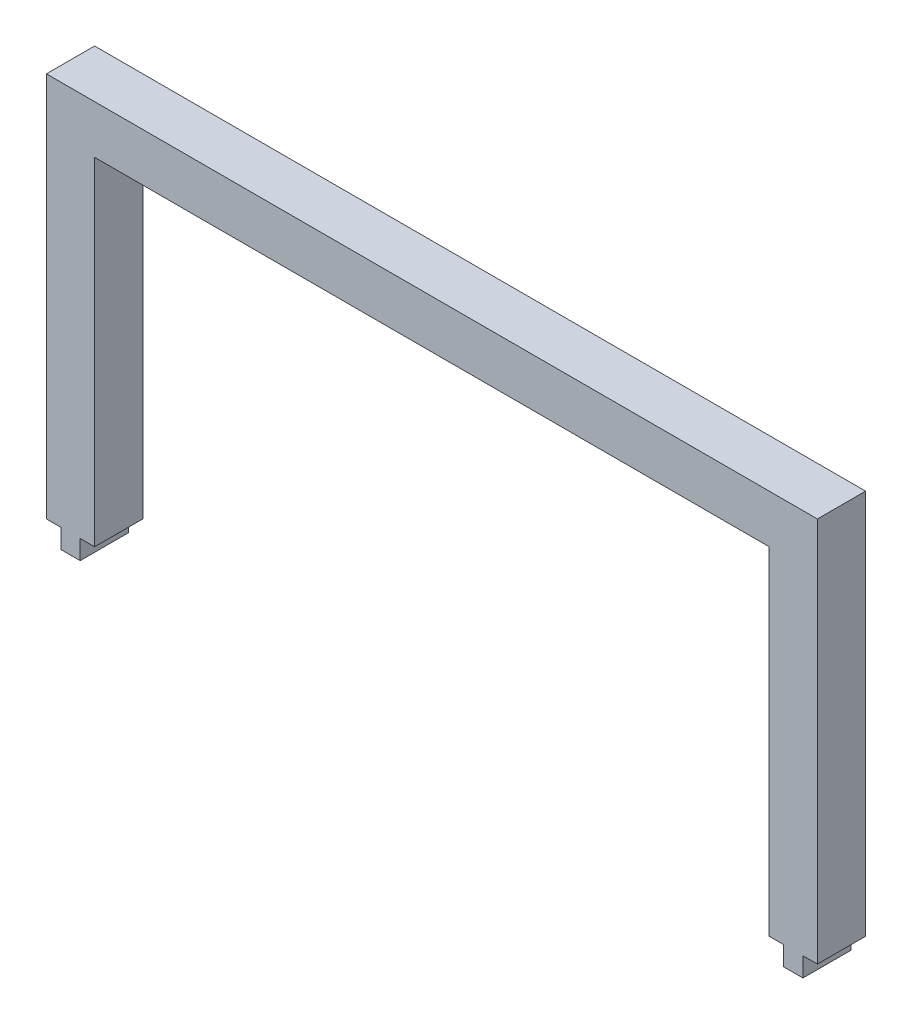
from build123d import *

# Parameters (mm, degrees)
BOSS_EXTRUDE1_DEPTH = 50


with BuildPart() as part:
    # Sketch1 → Boss-Extrude1 (new body)
    with BuildSketch(Plane.XY):
        Polygon((297.133757962, 247.133757962), (-502.866242038, 247.133757962), (-502.866242038, -152.866242038), (-487.866242038, -152.866242038), (-487.866242038, -172.866242038), (-467.866242038, -172.866242038), (-467.866242038, -152.866242038), (-452.866242038, -152.866242038), (-452.866242038, 197.133757962), (247.133757962, 197.133757962), (247.133757962, -152.866242038), (262.133757962, -152.866242038), (262.133757962, -172.866242038), (282.133757962, -172.866242038), (282.133757962, -152.866242038), (297.133757962, -152.866242038), align=None)
    extrude(amount=BOSS_EXTRUDE1_DEPTH)


solid = part.part
